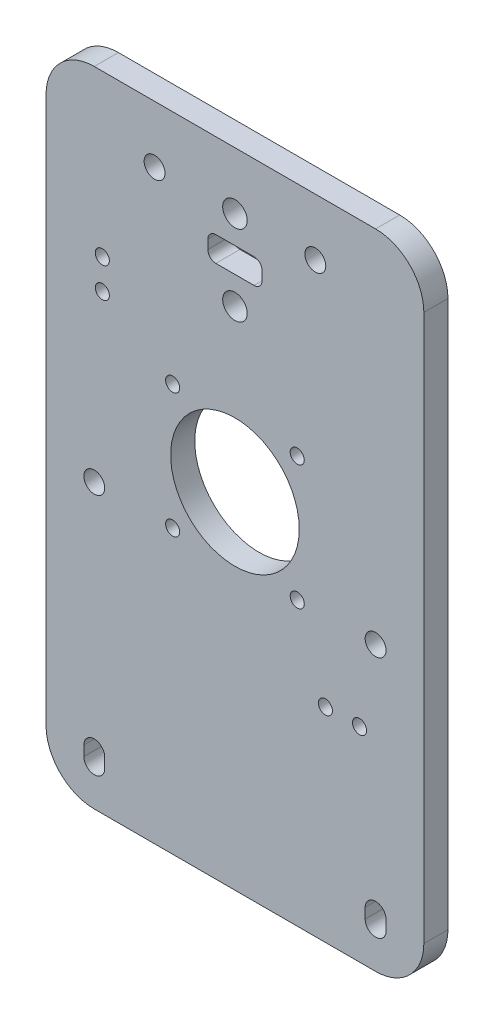
from build123d import *

# Parameters (mm, degrees)
MODEL_R                         = 2.6
MODEL_R_2                       = 16
MODEL_R_3                       = 3.05
MODEL_W                         = 13.5
MODEL_H                         = 6.2
BASE_DEPTH                      = 6
FILLETCABLESLOT_R               = 2
F_3_2_3_2_STEPPER_MOUNT_HOLES_D = 3.5
F_3_5_3_5_SENSORMOUNT_D         = 3.5
F_3_5_3_5_CABLEMOUNT_D          = 3.5


with BuildPart() as part:
    # Model → Base (new body)
    with BuildSketch(Plane.XY):
        with BuildLine():
            Line((35, 160), (-35, 160))
            ThreePointArc((-35, 160), (-43.485281374, 156.485281374), (-47, 148))
            Line((-47, 148), (-47, 12))
            ThreePointArc((-47, 12), (-43.485281374, 3.514718626), (-35, 0))
            Line((-35, 0), (35, 0))
            ThreePointArc((35, 0), (43.485281374, 3.514718626), (47, 12))
            Line((47, 12), (47, 148))
            ThreePointArc((47, 148), (43.485281374, 156.485281374), (35, 160))
        make_face()
        with BuildLine():
            ThreePointArc((-37.6, 12.5), (-35, 15.1), (-32.4, 12.5))
            Line((-32.4, 12.5), (-32.4, 10))
            ThreePointArc((-32.4, 10), (-35, 7.4), (-37.6, 10))
            Line((-37.6, 10), (-37.6, 12.5))
        make_face(mode=Mode.SUBTRACT)
        with Locations((-35, 70.45)):
            Circle(MODEL_R, mode=Mode.SUBTRACT)
        with BuildLine():
            Line((32.4, 10), (32.4, 12.5))
            ThreePointArc((32.4, 12.5), (35, 15.1), (37.6, 12.5))
            Line((37.6, 12.5), (37.6, 10))
            ThreePointArc((37.6, 10), (35, 7.4), (32.4, 10))
        make_face(mode=Mode.SUBTRACT)
        with Locations((35, 70.45)):
            Circle(MODEL_R, mode=Mode.SUBTRACT)
        with Locations((-20, 145.8)):
            Circle(MODEL_R, mode=Mode.SUBTRACT)
        with Locations((0, 85.8)):
            Circle(MODEL_R_2, mode=Mode.SUBTRACT)
        with Locations((0, 125.8)):
            Circle(MODEL_R_3, mode=Mode.SUBTRACT)
        with Locations((0, 135.8)):
            Rectangle(MODEL_W, MODEL_H, mode=Mode.SUBTRACT)
        with Locations((0, 145.8)):
            Circle(MODEL_R_3, mode=Mode.SUBTRACT)
        with Locations((20, 145.8)):
            Circle(MODEL_R, mode=Mode.SUBTRACT)
    extrude(amount=BASE_DEPTH)

    # FilletCableSlot
    filletcableslot_edges = [part.edges().sort_by_distance(p)[0] for p in [
        (6.75, 138.9, 3),
        (-6.75, 138.9, 3),
        (-6.75, 132.7, 3),
        (6.75, 132.7, 3),
    ]]
    fillet(filletcableslot_edges, radius=FILLETCABLESLOT_R)

    # Ø3.2 (3.2) Stepper mount Holes (through all)
    with Locations(Plane.XY.offset(6)):
        with Locations((-15.5, 101.3), (-15.5, 70.3), (15.5, 70.3), (15.5, 101.3)):
            Hole(F_3_2_3_2_STEPPER_MOUNT_HOLES_D / 2)

    # Ø3.5 (3.5) SensorMount (through all)
    with Locations(Plane.XY.offset(6)):
        with Locations((-33, 120), (-33, 112.5)):
            Hole(F_3_5_3_5_SENSORMOUNT_D / 2)

    # Ø3.5 (3.5) CableMount (through all)
    with Locations(Plane.XY.offset(6)):
        with Locations((22.5, 50.76), (31, 50.76)):
            Hole(F_3_5_3_5_CABLEMOUNT_D / 2)


solid = part.part
